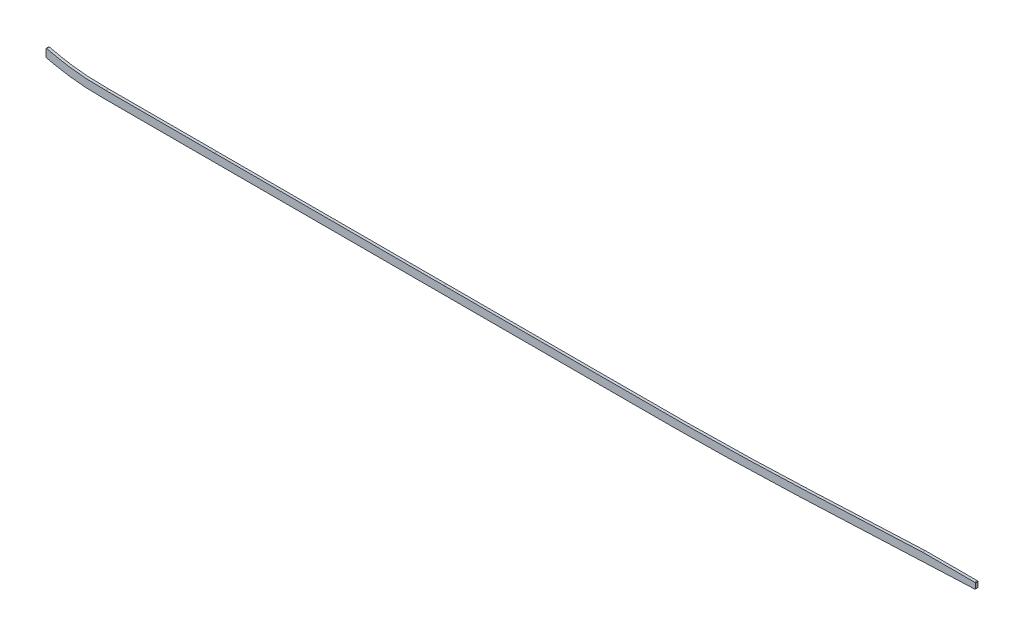
from build123d import *

# Parameters (mm, degrees)
BOSS_EXTRUDE1_DEPTH = 3.175
CUT_EXTRUDE1_DEPTH  = 2671.08300446
FILLET1_R           = 1.27


with BuildPart() as part:
    # Sketch1 → Boss-Extrude1 (new, symmetric)
    with BuildSketch(Plane.XY):
        with BuildLine():
            Line((499.61002795, -53.470702797), (1046.28548189, -53.470702797))
            add(Edge.make_bspline(
                [(2669.54, -9.569049356), (2615.393603553, -13.17073937), (2561.080658619, -16.536108081), (2506.205230446, -19.758621957), (2430.209106802, -23.505211705), (2354.212983157, -26.631486423), (2332.570330468, -27.480988169), (2156.268639429, -34.377768543), (1979.966947376, -41.628631248), (1824.114277635, -52.771265877), (1636.928606778, -53.579569849), (1449.742935921, -53.454024613), (1418.006730935, -53.470702797), (1324.899336146, -53.470702797), (1231.791940344, -53.470702797), (1170.441269319, -53.470702797), (1108.784075813, -53.470702797), (1047.126882346, -53.470702797), (1046.846414188, -53.470702797), (1046.565947184, -53.470702797), (1046.28548189, -53.470702797)],
                knots=[103.698913506, 103.698913506, 103.698913506, 103.698913506, 103.698913506, 103.698913506, 130.927896619, 130.927896619, 130.927896619, 141.337054719, 141.337054719, 141.337054719, 218.101815019, 218.101815019, 218.101815019, 233.772059419, 233.772059419, 233.772059419, 264.077723219, 264.077723219, 264.077723219, 264.2162088, 264.2162088, 264.2162088, 264.2162088, 264.2162088, 264.2162088], degree=5))
            Line((2669.54, -9.569049356), (2669.54, 9.5231025))
            add(Edge.make_bspline(
                [(2669.54, 9.5231025), (2667.126494524, 9.36235515), (2659.861586685, 8.880281494), (2635.666282302, 7.292469146), (2596.857665529, 4.826056853), (2545.729743039, 1.758344093), (2494.405305707, -1.098555235), (2451.533022267, -3.266573297), (2417.198316756, -4.86708361), (2391.457076919, -6.003589235), (2365.634736307, -7.086854581), (2339.546284672, -8.137729944), (2313.466132974, -9.165138371), (2287.612375486, -10.179478215), (2261.763347437, -11.201032297), (2227.285329715, -12.583842557), (2184.175569393, -14.36607236), (2132.429066114, -16.607427868), (2063.4255234, -19.708920485), (1977.174907635, -23.700543313), (1873.732451432, -28.149389221), (1770.37461881, -31.657468649), (1667.085687813, -33.793117556), (1581.011094491, -34.383188831), (1512.07397126, -34.4278026), (1443.061513477, -34.409510402), (1356.800927879, -34.424432812), (1218.794626954, -34.418464788), (1115.289022786, -34.420702797), (1046.28548189, -34.420702797)],
                knots=[103.571582669, 103.571582669, 103.571582669, 103.571582669, 104.300777207, 105.766098403, 110.877392287, 115.98868617, 121.099980054, 126.211273938, 128.76692088, 131.322567822, 133.878214764, 136.433861706, 138.989508647, 141.545155589, 144.100802531, 146.656449473, 151.767743357, 156.879037241, 161.990331124, 172.212918892, 182.43550666, 192.658094427, 202.880682195, 213.103269962, 218.214563846, 223.32585773, 233.548445497, 243.771033265, 264.2162088, 264.2162088, 264.2162088, 264.2162088], degree=3))
            Line((1046.28548189, -34.420702797), (499.61002795, -34.420702797))
            add(Edge.make_bspline(
                [(499.61002795, -34.420702797), (488.614737518, -34.420702797), (472.236395365, -34.420702798), (449.940231846, -34.420702794), (427.771305695, -34.42070281), (405.874681663, -34.420702712), (384.584909128, -34.420702942), (368.900229326, -34.420702244), (353.376568613, -34.420704862), (332.608466435, -34.420689186), (306.287754853, -34.420570006), (274.023487704, -34.420538256), (252.271015965, -34.420709741), (241.425150134, -34.420702761)],
                knots=[19.90682951, 19.90682951, 19.90682951, 19.90682951, 23.220120017, 24.876765271, 26.533410525, 29.846701033, 31.503346286, 33.15999154, 34.816636794, 36.473282048, 39.786572556, 43.099863063, 46.413153571, 46.413153571, 46.413153571, 46.413153571], degree=3))
            add(Edge.make_bspline(
                [(241.425150134, -34.420702761), (239.394928853, -34.420701455), (235.322322927, -34.420495867), (227.274423443, -34.398702533), (217.319360062, -34.297466855), (205.530690077, -33.976385563), (189.963341914, -33.212641271), (170.696984653, -31.543495194), (147.533261232, -28.314398128), (125.482753206, -24.202109872), (109.358914834, -20.622537553), (100.964116069, -18.612521054), (99.06, -18.149327722)],
                knots=[0, 0, 0, 0, 0.622088422, 1.244176844, 2.488353689, 3.732530533, 4.976707377, 7.465061066, 9.953414755, 12.441768444, 14.55823542, 15.180323842, 15.180323842, 15.180323842, 15.180323842], degree=3))
            Line((99.06, -18.149327722), (99.06, -37.741485304))
            add(Edge.make_bspline(
                [(241.425137875, -53.470702761), (224.286916993, -53.470691732), (207.149474967, -53.467315374), (190.203897513, -52.686577078), (161.734965878, -49.987457476), (133.266034188, -45.175583375), (121.749620566, -42.910592695), (110.349390726, -40.420274627), (99.06, -37.741485304)],
                knots=[0, 0, 0, 0, 0, 0, 8.71381608, 8.71381608, 8.71381608, 14.701907176, 14.701907176, 14.701907176, 14.701907176, 14.701907176, 14.701907176], degree=5))
            add(Edge.make_bspline(
                [(499.61002795, -53.470702797), (492.136820835, -53.470702797), (484.754348064, -53.470702797), (477.443025859, -53.470702797), (448.516583145, -53.470702797), (419.590140517, -53.470702797), (398.368118521, -53.470702797), (355.647540186, -53.470702797), (312.926961851, -53.470702797), (289.235090436, -53.470293029), (265.364963651, -53.470705034), (241.4948369, -53.470702789), (241.471603891, -53.470702785), (241.448370882, -53.470702776), (241.425137875, -53.470702761)],
                knots=[19.90682951, 19.90682951, 19.90682951, 19.90682951, 19.90682951, 19.90682951, 23.637897311, 23.637897311, 23.637897311, 34.276545571, 34.276545571, 34.276545571, 46.401340901, 46.401340901, 46.401340901, 46.413153571, 46.413153571, 46.413153571, 46.413153571, 46.413153571, 46.413153571], degree=5))
        make_face()
    extrude(amount=BOSS_EXTRUDE1_DEPTH, both=True)

    # Sketch2 → Cut-Extrude1 (cut, through all)
    with BuildSketch(Plane.XY.offset(3.175)):
        with BuildLine():
            Line((2185.532985525, -14.325659725), (2311.4, -14.325659725))
            Line((2311.4, -14.325659725), (2311.4, -28.310356345))
            add(Edge.make_bspline(
                [(2669.54, -9.569049356), (2615.393603553, -13.17073937), (2561.080658619, -16.536108081), (2506.205230446, -19.758621957), (2434.382223772, -23.29947809), (2362.559217098, -26.286274493), (2345.393069943, -26.972929947), (2328.342945407, -27.644579597), (2311.4, -28.310356345)],
                knots=[103.698913506, 103.698913506, 103.698913506, 103.698913506, 103.698913506, 103.698913506, 130.927896619, 130.927896619, 130.927896619, 139.270260279, 139.270260279, 139.270260279, 139.270260279, 139.270260279, 139.270260279], degree=5))
            Line((2669.54, -9.569049356), (2669.54, 9.5231025))
            add(Edge.make_bspline(
                [(2669.54, 9.5231025), (2667.126494524, 9.36235515), (2659.861586685, 8.880281494), (2635.666282302, 7.292469146), (2596.857665529, 4.826056853), (2545.729743039, 1.758344093), (2494.405305707, -1.098555235), (2451.533022267, -3.266573297), (2417.198316756, -4.86708361), (2391.457076919, -6.003589235), (2365.634736307, -7.086854581), (2339.546284672, -8.137729944), (2313.466132974, -9.165138371), (2287.612375486, -10.179478215), (2261.763347437, -11.201032297), (2227.738431725, -12.565669989), (2202.325932618, -13.615715702), (2185.532985525, -14.325659725)],
                knots=[103.571582669, 103.571582669, 103.571582669, 103.571582669, 104.300777207, 105.766098403, 110.877392287, 115.98868617, 121.099980054, 126.211273938, 128.76692088, 131.322567822, 133.878214764, 136.433861706, 138.989508647, 141.545155589, 144.100802531, 146.656449473, 151.63340051, 151.63340051, 151.63340051, 151.63340051], degree=3))
        make_face()
    extrude(amount=-CUT_EXTRUDE1_DEPTH, mode=Mode.SUBTRACT)

    # Fillet1
    fillet1_edges = [part.edges().sort_by_distance(p)[0] for p in [
        (99.06, -37.741485304, -1.5875),
        (99.06, -18.149327722, -1.5875),
        (2311.4, -14.325659725, 0),
        (2311.4, -28.310356345, 1.5875),
    ]]
    fillet(fillet1_edges, radius=FILLET1_R)


solid = part.part
